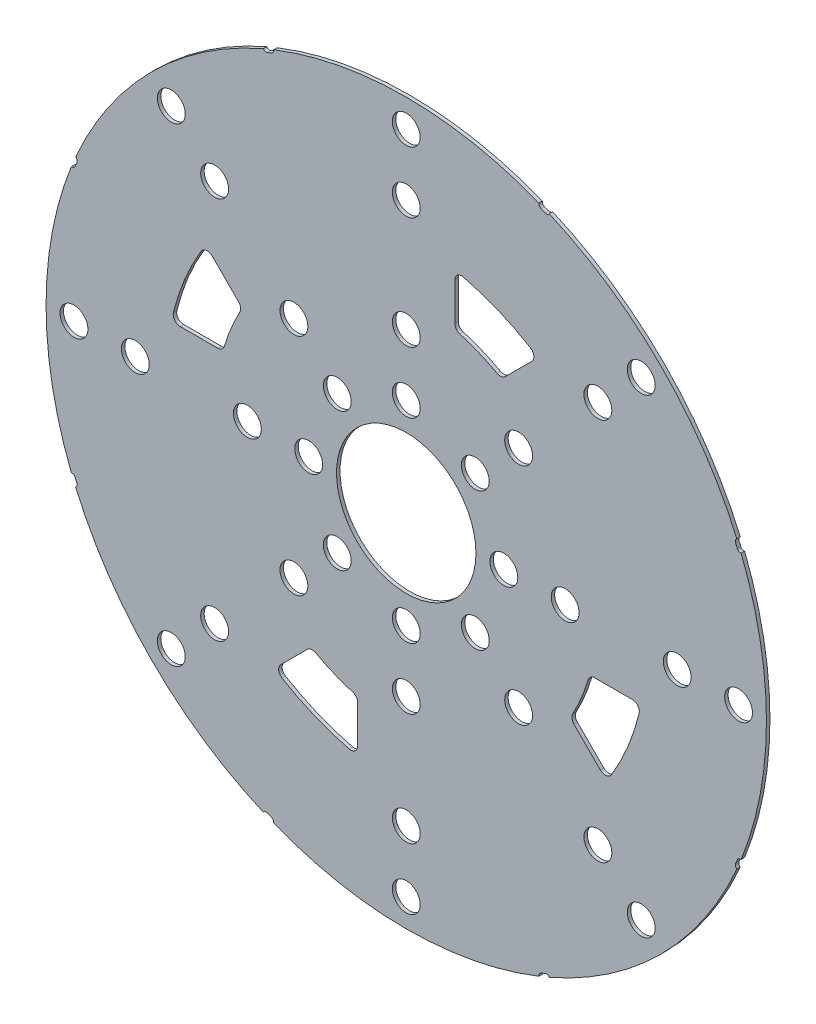
from build123d import *

# Parameters (mm, degrees)
SKETCH4_R           = 82.042
BOSS_EXTRUDE2_DEPTH = 0.79375
SKETCH5_R           = 15.875
CUT_EXTRUDE5_DEPTH  = 117.027624155
CUT_EXTRUDE11_DEPTH = 117.027624155
SKETCH9_R           = 3.175
CUT_EXTRUDE12_DEPTH = 117.027624155
FILLET1_R           = 1.5875
FILLET2_R           = 0.79375


with BuildPart() as part:
    # Sketch4 → Boss-Extrude2 (new body)
    with BuildSketch(Plane.XY):
        Circle(SKETCH4_R)
    extrude(amount=BOSS_EXTRUDE2_DEPTH)

    # Sketch5 → Cut-Extrude5 (cut, through all)
    with BuildSketch(Plane.XY.offset(0.79375)):
        Circle(SKETCH5_R)
    extrude(amount=-CUT_EXTRUDE5_DEPTH, mode=Mode.SUBTRACT)

    # Sketch8 → Cut-Extrude11 (cut, through all)
    with BuildSketch(Plane.XY.offset(0.79375)):
        Polygon((76.869596069, 30.465791131), (75.89758015, 32.812445144), (74.724253144, 32.326437185), (75.696269062, 29.979783172), align=None)
        Polygon((-30.465791131, 76.869596069), (-32.812445144, 75.89758015), (-32.326437185, 74.724253144), (-29.979783172, 75.696269062), align=None)
        Polygon((-75.89758015, 32.812445144), (-76.869596069, 30.465791131), (-75.696269062, 29.979783172), (-74.724253144, 32.326437185), align=None)
        Polygon((-76.869596069, -30.465791131), (-75.89758015, -32.812445144), (-74.724253144, -32.326437185), (-75.696269062, -29.979783172), align=None)
        Polygon((-32.812445144, -75.89758015), (-30.465791131, -76.869596069), (-29.979783172, -75.696269062), (-32.326437185, -74.724253144), align=None)
        Polygon((30.465791131, -76.869596069), (32.812445144, -75.89758015), (32.326437185, -74.724253144), (29.979783172, -75.696269062), align=None)
        Polygon((75.89758015, -32.812445144), (76.869596069, -30.465791131), (75.696269062, -29.979783172), (74.724253144, -32.326437185), align=None)
        Polygon((32.812445144, 75.89758015), (30.465791131, 76.869596069), (29.979783172, 75.696269062), (32.326437185, 74.724253144), align=None)
    extrude(amount=-CUT_EXTRUDE11_DEPTH, mode=Mode.SUBTRACT)

    # Sketch9 → Cut-Extrude12 (cut, through all)
    with BuildSketch(Plane.XY.offset(0.79375)):
        with Locations((22.225, 0)):
            Circle(SKETCH9_R)
        with Locations((36.195, 0)):
            Circle(SKETCH9_R)
        with Locations((61.722, 0)):
            Circle(SKETCH9_R)
        with Locations((75.691993951, 0)):
            Circle(SKETCH9_R)
        with Locations((15.715448212, -15.715448212)):
            Circle(SKETCH9_R)
        with Locations((25.593729945, -25.593729945)):
            Circle(SKETCH9_R)
        with Locations((43.644044748, -43.644044748)):
            Circle(SKETCH9_R)
        with Locations((53.522322204, -53.522322204)):
            Circle(SKETCH9_R)
        with Locations((0, -22.225)):
            Circle(SKETCH9_R)
        with Locations((0, -36.195)):
            Circle(SKETCH9_R)
        with Locations((0, -61.722)):
            Circle(SKETCH9_R)
        with Locations((0, -75.691993951)):
            Circle(SKETCH9_R)
        with Locations((-15.715448212, -15.715448212)):
            Circle(SKETCH9_R)
        with Locations((-25.593729945, -25.593729945)):
            Circle(SKETCH9_R)
        with Locations((-43.644044748, -43.644044748)):
            Circle(SKETCH9_R)
        with Locations((-53.522322204, -53.522322204)):
            Circle(SKETCH9_R)
        with Locations((-22.225, 0)):
            Circle(SKETCH9_R)
        with Locations((-36.195, 0)):
            Circle(SKETCH9_R)
        with Locations((-61.722, 0)):
            Circle(SKETCH9_R)
        with Locations((-75.691993951, 0)):
            Circle(SKETCH9_R)
        with Locations((-15.715448212, 15.715448212)):
            Circle(SKETCH9_R)
        with Locations((-25.593729945, 25.593729945)):
            Circle(SKETCH9_R)
        with Locations((-43.644044748, 43.644044748)):
            Circle(SKETCH9_R)
        with Locations((-53.522322204, 53.522322204)):
            Circle(SKETCH9_R)
        with Locations((0, 22.225)):
            Circle(SKETCH9_R)
        with Locations((0, 36.195)):
            Circle(SKETCH9_R)
        with Locations((0, 61.722)):
            Circle(SKETCH9_R)
        with Locations((0, 75.691993951)):
            Circle(SKETCH9_R)
        with Locations((15.715448212, 15.715448212)):
            Circle(SKETCH9_R)
        with Locations((25.593729945, 25.593729945)):
            Circle(SKETCH9_R)
        with Locations((43.644044748, 43.644044748)):
            Circle(SKETCH9_R)
        with Locations((53.522322204, 53.522322204)):
            Circle(SKETCH9_R)
        with BuildLine():
            Line((21.703545506, 37.329191157), (30.003653075, 45.629298725))
            ThreePointArc((30.003653075, 45.629298725), (20.898342241, 50.45306127), (11.049, 53.480573099))
            Line((11.049, 53.480573099), (11.049, 41.742448407))
            ThreePointArc((11.049, 41.742448407), (16.52427061, 39.893118214), (21.703545506, 37.329191157))
        make_face()
        with BuildLine():
            Line((41.742448407, -11.049), (53.480573099, -11.049))
            ThreePointArc((53.480573099, -11.049), (50.45306127, -20.898342241), (45.629298725, -30.003653075))
            Line((45.629298725, -30.003653075), (37.329191157, -21.703545506))
            ThreePointArc((37.329191157, -21.703545506), (39.893118214, -16.52427061), (41.742448407, -11.049))
        make_face()
        with BuildLine():
            Line((-11.049, -41.742448407), (-11.049, -53.480573099))
            ThreePointArc((-11.049, -53.480573099), (-20.898342241, -50.45306127), (-30.003653075, -45.629298725))
            Line((-30.003653075, -45.629298725), (-21.703545506, -37.329191157))
            ThreePointArc((-21.703545506, -37.329191157), (-16.52427061, -39.893118214), (-11.049, -41.742448407))
        make_face()
        with BuildLine():
            Line((-41.742448407, 11.049), (-53.480573099, 11.049))
            ThreePointArc((-53.480573099, 11.049), (-50.45306127, 20.898342241), (-45.629298725, 30.003653075))
            Line((-45.629298725, 30.003653075), (-37.329191157, 21.703545506))
            ThreePointArc((-37.329191157, 21.703545506), (-39.893118214, 16.52427061), (-41.742448407, 11.049))
        make_face()
    extrude(amount=-CUT_EXTRUDE12_DEPTH, mode=Mode.SUBTRACT)

    # Fillet1
    fillet1_edges = [part.edges().sort_by_distance(p)[0] for p in [
        (21.703545506, 37.329191157, 0.396875),
        (11.049, 41.742448407, 0.396875),
        (11.049, 53.480573099, 0.396875),
        (30.003653075, 45.629298725, 0.396875),
        (37.329191157, -21.703545506, 0.396875),
        (41.742448407, -11.049, 0.396875),
        (53.480573099, -11.049, 0.396875),
        (45.629298725, -30.003653075, 0.396875),
        (-21.703545506, -37.329191157, 0.396875),
        (-11.049, -41.742448407, 0.396875),
        (-11.049, -53.480573099, 0.396875),
        (-30.003653075, -45.629298725, 0.396875),
        (-37.329191157, 21.703545506, 0.396875),
        (-41.742448407, 11.049, 0.396875),
        (-53.480573099, 11.049, 0.396875),
        (-45.629298725, 30.003653075, 0.396875),
    ]]
    fillet(fillet1_edges, radius=FILLET1_R)

    # Fillet2
    # the kernel refuses this fillet: 0.79375 mm, written as the material it adds along each edge
    with BuildSketch(Plane(origin=(-75.696269062, 29.979783172, 0.79375), x_dir=(0.3826834323651269, 0.9238795325112714, 0), z_dir=(0, 0, -1)), Plane(origin=(-32.326437185, 74.724253144, 0.79375), x_dir=(0.9238795325112888, 0.382683432365085, 0), z_dir=(0, 0, -1))) as fillet2_piece_1:
        with BuildLine():
            CenterArc((0.775641503, -0.79375), FILLET2_R, 90, 77.737864874)
            Line((0, -0.62516969), (-0.01551283, -0.621798083))
            ThreePointArc((-0.01551283, -0.621798083), (-0.015875, -0.312584845), (-0.015875, 0))
            Line((-0.015875, 0), (0, 0.015875))
            Line((0, 0.015875), (0.775641503, 0.015875))
            Line((0.775641503, 0.015875), (0.775641503, 0))
        make_face()
    extrude(amount=0.79375)
    with BuildSketch(Plane(origin=(-29.979783172, 75.696269062, 0.79375), x_dir=(-0.3826834323684612, 0.9238795325098903, 0), z_dir=(0, 0, -1)), Plane(origin=(-74.724253144, 32.326437185, 0.79375), x_dir=(-0.9238795325127166, 0.38268343236163754, 0), z_dir=(0, 0, -1))) as fillet2_piece_2:
        with BuildLine():
            CenterArc((0.79375, -0.775641503), FILLET2_R, 102.262135126, 77.737864874)
            Line((0, -0.775641503), (-0.015875, -0.775641503))
            Line((-0.015875, -0.775641503), (-0.015875, 0))
            Line((-0.015875, 0), (0, 0.015875))
            ThreePointArc((0, 0.015875), (0.312584845, 0.015875), (0.621798083, 0.01551283))
            Line((0.621798083, 0.01551283), (0.62516969, 0))
        make_face()
    extrude(amount=0.79375)
    with BuildSketch(Plane(origin=(-74.724253144, -32.326437185, 0.79375), x_dir=(-0.9238795325128379, -0.3826834323613448, 0), z_dir=(0, 0, -1)), Plane(origin=(-29.979783172, -75.696269062, 0.79375), x_dir=(-0.3826834323686382, -0.9238795325098169, 0), z_dir=(0, 0, -1)), Plane(origin=(32.326437185, -74.724253144, 0.79375), x_dir=(0.3826834323615479, -0.9238795325127538, 0), z_dir=(0, 0, -1))) as fillet2_piece_3:
        with BuildLine():
            CenterArc((0.79375, 0.775641503), FILLET2_R, 180, 77.737864874)
            Line((0, 0.775641503), (-0.015875, 0.775641503))
            Line((-0.015875, 0.775641503), (-0.015875, 0))
            Line((-0.015875, 0), (0, -0.015875))
            ThreePointArc((0, -0.015875), (0.312584845, -0.015875), (0.621798083, -0.01551283))
            Line((0.621798083, -0.01551283), (0.62516969, 0))
        make_face()
    extrude(amount=0.79375)
    with BuildSketch(Plane(origin=(-75.696269062, -29.979783172, 0.79375), x_dir=(0.3826834323649975, -0.923879532511325, 0), z_dir=(0, 0, -1)), Plane(origin=(-32.326437185, -74.724253144, 0.79375), x_dir=(0.9238795325112237, -0.38268343236524216, 0), z_dir=(0, 0, -1)), Plane(origin=(29.979783172, -75.696269062, 0.79375), x_dir=(0.9238795325113635, 0.38268343236490476, 0), z_dir=(0, 0, -1))) as fillet2_piece_4:
        with BuildLine():
            CenterArc((0.775641503, 0.79375), FILLET2_R, 192.262135126, 77.737864874)
            Line((0, 0.62516969), (-0.01551283, 0.621798083))
            ThreePointArc((-0.01551283, 0.621798083), (-0.015875, 0.312584845), (-0.015875, 0))
            Line((-0.015875, 0), (0, -0.015875))
            Line((0, -0.015875), (0.775641503, -0.015875))
            Line((0.775641503, -0.015875), (0.775641503, 0))
        make_face()
    extrude(amount=0.79375)
    with BuildSketch(Plane(origin=(75.696269062, -29.979783172, 0.79375), x_dir=(0.9238795325097092, -0.382683432368898, 0), z_dir=(0, 0, -1))) as fillet2_piece_5:
        with BuildLine():
            CenterArc((0.79375, 0.775641503), FILLET2_R, 180, 77.737864875)
            Line((0, 0.775641503), (-0.015875, 0.775641503))
            Line((-0.015875, 0.775641503), (-0.015875, 0))
            Line((-0.015875, 0), (0, -0.015875))
            ThreePointArc((0, -0.015875), (0.312584845, -0.015875), (0.621798084, -0.01551283))
            Line((0.621798084, -0.01551283), (0.62516969, 0))
        make_face()
    extrude(amount=0.79375)
    with BuildSketch(Plane(origin=(74.724253144, -32.326437185, 0.79375), x_dir=(0.38268343236533003, 0.9238795325111873, 0), z_dir=(0, 0, -1))) as fillet2_piece_6:
        with BuildLine():
            CenterArc((0.775641503, 0.79375), FILLET2_R, 192.262135125, 77.737864875)
            Line((0, 0.62516969), (-0.01551283, 0.621798084))
            ThreePointArc((-0.01551283, 0.621798084), (-0.015875, 0.312584845), (-0.015875, 0))
            Line((-0.015875, 0), (0, -0.015875))
            Line((0, -0.015875), (0.775641503, -0.015875))
            Line((0.775641503, -0.015875), (0.775641503, 0))
        make_face()
    extrude(amount=0.79375)
    with BuildSketch(Plane(origin=(75.696269062, 29.979783172, 0.79375), x_dir=(0.9238795325100071, 0.3826834323681794, 0), z_dir=(0, 0, -1)), Plane(origin=(32.326437185, 74.724253144, 0.79375), x_dir=(0.3826834323619378, 0.9238795325125924, 0), z_dir=(0, 0, -1))) as fillet2_piece_7:
        with BuildLine():
            CenterArc((0.79375, -0.775641503), FILLET2_R, 102.262135126, 77.737864875)
            Line((0, -0.775641503), (-0.015875, -0.775641503))
            Line((-0.015875, -0.775641503), (-0.015875, 0))
            Line((-0.015875, 0), (0, 0.015875))
            ThreePointArc((0, 0.015875), (0.312584845, 0.015875), (0.621798084, 0.01551283))
            Line((0.621798084, 0.01551283), (0.62516969, 0))
        make_face()
    extrude(amount=0.79375)
    with BuildSketch(Plane(origin=(74.724253144, 32.326437185, 0.79375), x_dir=(0.3826834323648073, -0.9238795325114039, 0), z_dir=(0, 0, -1)), Plane(origin=(29.979783172, 75.696269062, 0.79375), x_dir=(0.9238795325111434, -0.38268343236543584, 0), z_dir=(0, 0, -1))) as fillet2_piece_8:
        with BuildLine():
            CenterArc((0.775641503, -0.79375), FILLET2_R, 90, 77.737864875)
            Line((0, -0.62516969), (-0.01551283, -0.621798084))
            ThreePointArc((-0.01551283, -0.621798084), (-0.015875, -0.312584845), (-0.015875, 0))
            Line((-0.015875, 0), (0, 0.015875))
            Line((0, 0.015875), (0.775641503, 0.015875))
            Line((0.775641503, 0.015875), (0.775641503, 0))
        make_face()
    extrude(amount=0.79375)


solid = part.part
